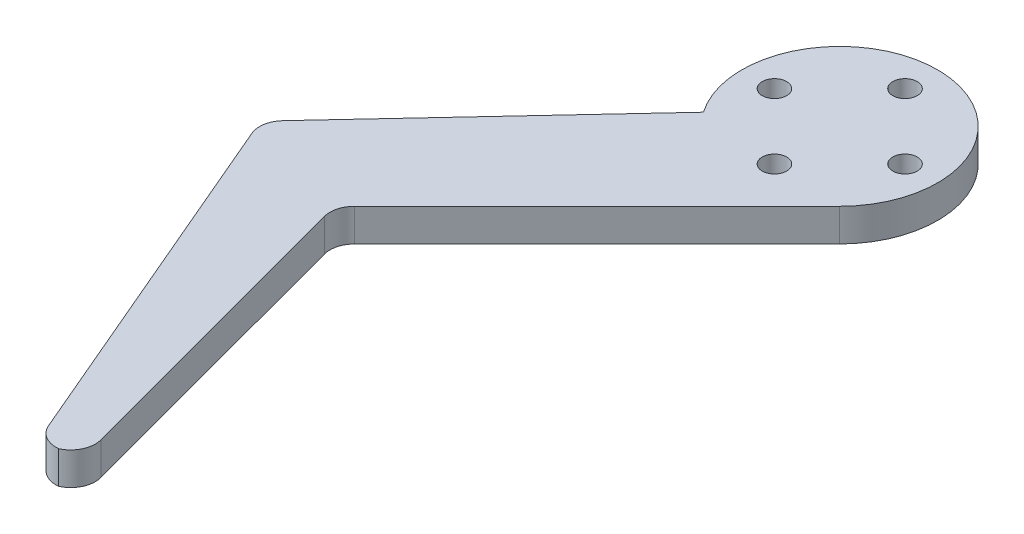
from build123d import *

# Parameters (mm, degrees)
ESQUISSE1_R        = 1.5
BOSS_EXTRU_1_DEPTH = 4
CONG_1_R           = 3


with BuildPart() as part:
    # Esquisse1 → Boss.-Extru.1 (new body)
    with BuildSketch(Plane(origin=(0, 0, 0), x_dir=(1, 0, 0), z_dir=(0, 1, 0))):
        with BuildLine():
            Line((8.485281374, -8.485281374), (0, -16.970562748))
            Line((0, -16.970562748), (-22.464310668, -39.434873416))
            Line((-22.464310668, -39.434873416), (-11.218828677, -81.452465455))
            Line((-11.218828677, -81.452465455), (-15.680045384, -82.646454204))
            Line((-15.680045384, -82.646454204), (-36.047749068, -34.943524646))
            Line((-36.047749068, -34.943524646), (-9.851595733, -6.851719603))
            ThreePointArc((-9.851595733, -6.851719603), (1.064816767, 11.952663521), (8.485281374, -8.485281374))
        make_face()
        with Locations(Location((0, 8, 0), (0, 0, 270))):
            Circle(ESQUISSE1_R, mode=Mode.SUBTRACT)
        with Locations(Location((8, 0, 0), (0, 0, 270))):
            Circle(ESQUISSE1_R, mode=Mode.SUBTRACT)
        with Locations(Location((0, -8, 0), (0, 0, 270))):
            Circle(ESQUISSE1_R, mode=Mode.SUBTRACT)
        with Locations(Location((-8, 0, 0), (0, 0, 270))):
            Circle(ESQUISSE1_R, mode=Mode.SUBTRACT)
    extrude(amount=BOSS_EXTRU_1_DEPTH)

    # Congé1
    # the kernel refuses this fillet: 3 mm, written as the material it adds along each edge
    with BuildSketch(Plane(origin=(-22.464310668, 0, 39.434873416), x_dir=(0.7071067811865301, 0, -0.707106781186565), z_dir=(0, 1, 0))) as cong_1_piece_1:
        with BuildLine():
            CenterArc((CONG_1_R * 0.57715637581, -CONG_1_R), CONG_1_R, 90, 59.983334692)
            Line((-CONG_1_R * 0.288723559099, -CONG_1_R * 0.499748125118), (0, 0))
            Line((0, 0), (CONG_1_R * 0.57715637581, 0))
        make_face()
    extrude(amount=4)
    # the kernel refuses this fillet: 3 mm, written as the material it takes off along each edge
    with BuildSketch(Plane(origin=(-36.047749068, -4.881837421, 34.943524646), x_dir=(0.3926744141534844, 0, 0.9196775546185836), z_dir=(0, 1, 0))) as cong_1_2_piece_1:
        with BuildLine():
            CenterArc((CONG_1_R * 0.650911656199, CONG_1_R), CONG_1_R, 203.878855686, 66.121144314)
            Line((-CONG_1_R * 0.263491749375, CONG_1_R * 0.595195835156), (0, 0))
            Line((0, 0), (CONG_1_R * 0.650911656199, 0))
        make_face()
    extrude(amount=13.763674843, mode=Mode.SUBTRACT)
    with BuildSketch(Plane(origin=(-15.680045384, -6.503846863, 82.646454204), x_dir=(0.9660010666973496, 0, -0.25853808063722905), z_dir=(0, 1, 0))) as cong_1_2_piece_2:
        with BuildLine():
            CenterArc((CONG_1_R * 0.867179581778, CONG_1_R), CONG_1_R, 188.137677252, 81.862322748)
            Line((-CONG_1_R * 0.122751206352, CONG_1_R * 0.858447766839), (0, 0))
            Line((0, 0), (CONG_1_R * 0.867179581778, 0))
        make_face()
    extrude(amount=17.007693727, mode=Mode.SUBTRACT)
    with BuildSketch(Plane(origin=(-11.218828677, -7.5, 81.452465455), x_dir=(-0.2585380806372289, 0, -0.9660010666973499), z_dir=(0, 1, 0))) as cong_1_2_piece_3:
        with BuildLine():
            CenterArc((CONG_1_R, CONG_1_R), CONG_1_R, 180, 90)
            Line((0, CONG_1_R), (0, 0))
            Line((0, 0), (CONG_1_R, 0))
        make_face()
    extrude(amount=19, mode=Mode.SUBTRACT)


solid = part.part
